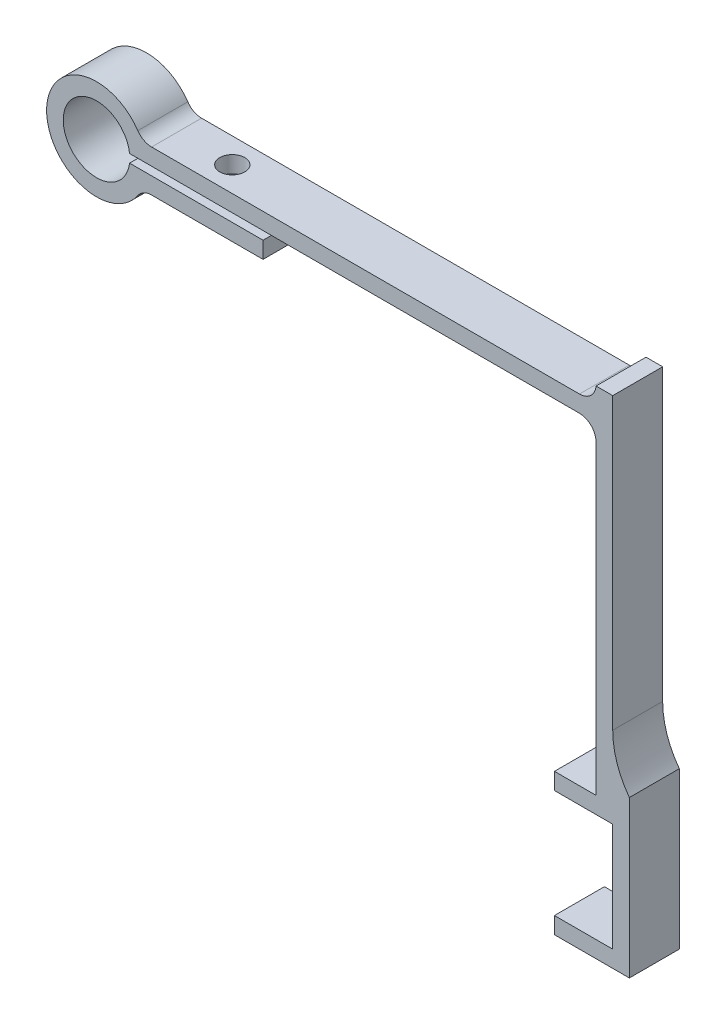
from build123d import *

# Parameters (mm, degrees)
BOSS_EXTRUDE1_DEPTH = 6
FILLET1_R           = 2
SKETCH2_R           = 1.5
CUT_EXTRUDE1_DEPTH  = 10
SKETCH3_W           = 6
SKETCH3_H           = 18.774257397
BOSS_EXTRUDE2_DEPTH = 2
FILLET2_R           = 10
SKETCH4_W           = 6
SKETCH4_H           = 2
BOSS_EXTRUDE3_DEPTH = 5
SKETCH5_W           = 6
SKETCH5_H           = 2
BOSS_EXTRUDE4_DEPTH = 7


with BuildPart() as part:
    # Sketch1 → Boss-Extrude1 (new body)
    with BuildSketch(Plane.XY):
        with BuildLine():
            Line((4.974937186, 0.5), (9.527119886, 0.5))
            Line((9.527119886, 0.5), (60, 0.5))
            Line((60, 0.5), (60, -40.25))
            Line((60, -40.25), (62, -40.25))
            Line((62, -40.25), (62, 4.331195296))
            Line((62, 4.331195296), (60, 4.331195296))
            Line((60, 4.331195296), (60, 2.5))
            Line((60, 2.5), (5.454356057, 2.5))
            ThreePointArc((5.454356057, 2.5), (-6, 0), (5.454356057, -2.5))
            Line((5.454356057, -2.5), (20, -2.5))
            Line((20, -2.5), (20, -0.5))
            Line((20, -0.5), (4.974937186, -0.5))
            Line((4.974937186, -0.5), (3.968626967, -0.5))
            ThreePointArc((3.968626967, -0.5), (-4, 0), (3.968626967, 0.5))
            Line((3.968626967, 0.5), (4.974937186, 0.5))
        make_face()
    extrude(amount=BOSS_EXTRUDE1_DEPTH)

    # Fillet1
    # the kernel refuses this fillet: 2 mm, written as the material it adds along each edge
    with BuildSketch(Plane(origin=(5.454356057, -2.5, 0), x_dir=(1, 0, 0), z_dir=(0, 0, 1))) as fillet1_piece_1:
        with BuildLine():
            CenterArc((1.16002222, -2), FILLET1_R, 90, 55.771133672)
            Line((-0.493572349, -0.875), (-0.52664424, -0.8525))
            ThreePointArc((-0.52664424, -0.8525), (-0.26328023, -0.428195989), (-0.036362374, 0.016666667))
            Line((-0.036362374, 0.016666667), (0, 0.04))
            Line((0, 0.04), (1.16002222, 0.04))
            Line((1.16002222, 0.04), (1.16002222, 0))
        make_face()
    extrude(amount=6)
    with BuildSketch(Plane(origin=(5.454356057, 2.5, 0), x_dir=(-0.491308051869414, 0.8709858771348026, 0), z_dir=(0, 0, 1))) as fillet1_piece_2:
        with BuildLine():
            CenterArc((1.172043497, -1.992979075), FILLET1_R, 94.802273988, 55.771133672)
            Line((-0.569928257, -1.010362971), (-0.604767692, -0.990710649))
            Line((-0.604767692, -0.990710649), (-0.034839435, 0.019652322))
            Line((-0.034839435, 0.019652322), (0.003348696, 0.039859581))
            ThreePointArc((0.003348696, 0.039859581), (0.502304356, 0.018937224), (1.001260016, 0.039859581))
            Line((1.001260016, 0.039859581), (1.004608712, 0))
        make_face()
    extrude(amount=6)
    with BuildSketch(Plane(origin=(60, 2.5, 0), x_dir=(-1, 0, 0), z_dir=(0, 0, 1))) as fillet1_piece_3:
        with BuildLine():
            CenterArc((1.992863511, -2), FILLET1_R, 90, 85.158341327)
            Line((0, -1.831195296), (-0.03985727, -1.827819202))
            ThreePointArc((-0.03985727, -1.827819202), (-0.04, -0.915597648), (-0.04, 0))
            Line((-0.04, 0), (0, 0.04))
            Line((0, 0.04), (1.992863511, 0.04))
            Line((1.992863511, 0.04), (1.992863511, 0))
        make_face()
    extrude(amount=6)
    with BuildSketch(Plane(origin=(60, 0.5, 0), x_dir=(-1, 0, 0), z_dir=(0, 0, 1))) as fillet1_piece_4:
        with BuildLine():
            CenterArc((FILLET1_R, FILLET1_R), FILLET1_R, 180, 90)
            Line((0, FILLET1_R), (-FILLET1_R * 0.02, FILLET1_R))
            Line((-FILLET1_R * 0.02, FILLET1_R), (-FILLET1_R * 0.02, -FILLET1_R * 0.02))
            Line((-FILLET1_R * 0.02, -FILLET1_R * 0.02), (FILLET1_R, -FILLET1_R * 0.02))
            Line((FILLET1_R, -FILLET1_R * 0.02), (FILLET1_R, 0))
        make_face()
    extrude(amount=6)

    # Sketch2 → Cut-Extrude1 (cut)
    with BuildSketch(Plane.XZ.offset(2.5)):
        with Locations((13.307189139, 3)):
            Circle(SKETCH2_R)
    extrude(amount=-CUT_EXTRUDE1_DEPTH, mode=Mode.SUBTRACT)

    # Sketch3 → Boss-Extrude2 (add)
    with BuildSketch(Plane(origin=(62, 0, 0), x_dir=(0, 0, -1), z_dir=(1, 0, 0))):
        with Locations((-3, -45.862871302)):
            Rectangle(SKETCH3_W, SKETCH3_H)
    extrude(amount=BOSS_EXTRUDE2_DEPTH)

    # Fillet2
    # the kernel refuses this fillet: 10 mm, written as the material it adds along each edge
    with BuildSketch(Plane(origin=(62, -36.475742603, 6), x_dir=(0, 1, 0), z_dir=(0, 0, -1))) as fillet2_piece_1:
        with BuildLine():
            CenterArc((6, 10), FILLET2_R, 233.130102354, 36.869897646)
            Line((0, 2), (-0.12, 1.84))
            ThreePointArc((-0.12, 1.84), (-0.2, 1), (-0.2, 0))
            Line((-0.2, 0), (0, -0.2))
            Line((0, -0.2), (6, -0.2))
            Line((6, -0.2), (6, 0))
        make_face()
    extrude(amount=6)

    # Sketch4 → Boss-Extrude3 (add)
    with BuildSketch(Plane.ZY.offset(-60)):
        with Locations((3, -39.25)):
            Rectangle(SKETCH4_W, SKETCH4_H)
    extrude(amount=BOSS_EXTRUDE3_DEPTH)

    # Sketch5 → Boss-Extrude4 (add)
    with BuildSketch(Plane.ZY.offset(-62)):
        with Locations((3, -54.25)):
            Rectangle(SKETCH5_W, SKETCH5_H)
    extrude(amount=BOSS_EXTRUDE4_DEPTH)


solid = part.part
